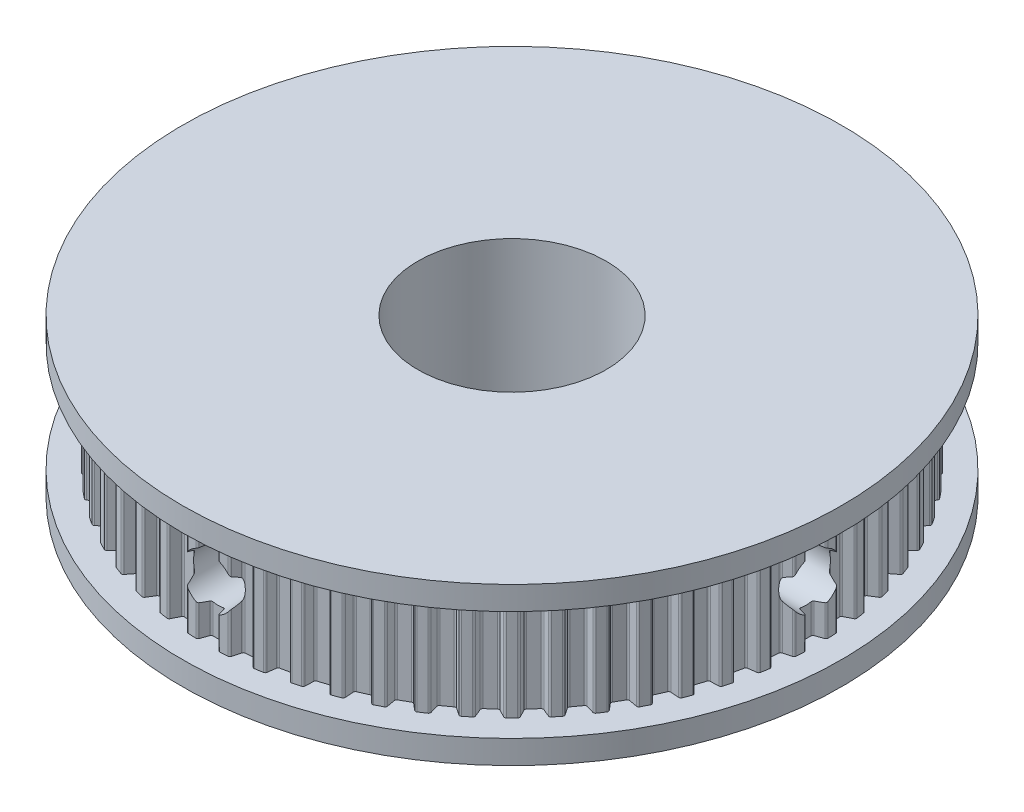
from build123d import *

# Parameters (mm, degrees)
EXTRUDE_1_DEPTH          = 3.5
EXTRUDE_1_DEPTH_BACK     = 3.5
SKETCH_1_R               = 19.405
CUT_EXTRUDE_1_DEPTH      = 29.321512142
FILLET_1_R               = 0.13
PATTERN_START            = -4
PATTERN_CIRCULAR_1_DEPTH = 8
SKETCH_3_R               = 21
EXTRUDE_2_DEPTH          = 1.5
EXTRUDE_START            = 1.5
SKETCH_4_R               = 21
EXTRUDE_3_DEPTH          = 1.5
SKETCH_5_R               = 6
CUT_EXTRUDE_2_DEPTH      = 32.336879232
SKETCH_9_W               = 1.65
SKETCH_9_H               = 21
PATTERN_CIRCULAR_2_COUNT = 2
PATTERN_CIRCULAR_2_ANGLE = 90


with BuildPart() as part:
    # 草圖1 → 填料-伸長1 (new, two sides: drawn at the far end of the back side and taken through both)
    with BuildSketch(Plane(origin=(0, 0, 0), x_dir=(1, 0, 0), z_dir=(0, 1, 0)).offset(-EXTRUDE_1_DEPTH_BACK)):
        with Locations(Location((0, 0, 0), (0, 0, 270))):
            Circle(SKETCH_1_R)
    extrude(amount=EXTRUDE_1_DEPTH + EXTRUDE_1_DEPTH_BACK)

    # 草圖2 → 除料-伸長1 (cut, through all)
    with BuildSketch(Plane.XZ.offset(3.5)):
        with BuildLine():
            Line((0, 18.715), (0, 19.405))
            ThreePointArc((0, 19.405), (-0.333532453, 19.402133416), (-0.666966365, 19.393534512))
            Line((-0.666966365, 19.393534512), (-0.42, 18.715))
            Line((-0.42, 18.715), (0, 18.715))
        make_face()
        with BuildLine():
            ThreePointArc((0.666966365, 19.393534512), (0.333532453, 19.402133416), (0, 19.405))
            Line((0, 19.405), (0, 18.715))
            Line((0, 18.715), (0.42, 18.715))
            Line((0.42, 18.715), (0.666966365, 19.393534512))
        make_face()
    extrude(amount=-CUT_EXTRUDE_1_DEPTH, mode=Mode.SUBTRACT)

    # 圓角1
    fillet_1_edges = [part.edges().sort_by_distance(p)[0] for p in [
        (0.42, 0, 18.715),
        (-0.42, 0, 18.715),
        (-0.666966365, 0, 19.393534512),
        (0.666966365, 0, 19.393534512),
    ]]
    fillet(fillet_1_edges, radius=FILLET_1_R)

    # 環狀複製排列1: read off the stored shape, not the designer's step
    # 環狀複製排列1 outline → 環狀複製排列1 (cut)
    with BuildSketch(Plane(origin=(0, 0, 0), x_dir=(1, 0, 0), z_dir=(0, 1, 0)).offset(PATTERN_START)):
        with BuildLine():
            ThreePointArc((-2.649001256, -19.132515222), (-2.705063815, -19.190443075), (-2.784498686, -19.20418163))
            ThreePointArc((-2.784498686, -19.20418163), (-2.02837483, -19.29869738), (-1.269123165, -19.363454015))
            ThreePointArc((-1.269123165, -19.363454015), (-1.343965787, -19.333500242), (-1.386759367, -19.265182191))
            Line((-1.386759367, -19.265182191), (-1.516529574, -18.744702316))
            ThreePointArc((-1.516529574, -18.744702316), (-1.557380345, -18.678039917), (-1.629079319, -18.646864316))
            Line((-1.629079319, -18.646864316), (-2.283421061, -18.578090228))
            ThreePointArc((-2.283421061, -18.578090228), (-2.360035012, -18.593677512), (-2.413852988, -18.650389825))
            Line((-2.413852988, -18.650389825), (-2.649001256, -19.132515222))
        make_face()
        with BuildLine():
            ThreePointArc((-4.634382164, -18.750809272), (-4.696192716, -18.802559656), (-4.776628505, -18.807919745))
            ThreePointArc((-4.776628505, -18.807919745), (-4.03452636, -18.980954192), (-3.286202867, -19.124719494))
            ThreePointArc((-3.286202867, -19.124719494), (-3.357504472, -19.087106627), (-3.392922443, -19.014689681))
            Line((-3.392922443, -19.014689681), (-3.467576794, -18.48349637))
            ThreePointArc((-3.467576794, -18.48349637), (-3.501235662, -18.412929086), (-3.569283123, -18.374429685))
            Line((-3.569283123, -18.374429685), (-4.212851464, -18.237635011))
            ThreePointArc((-4.212851464, -18.237635011), (-4.29067503, -18.245128568), (-4.350126236, -18.295904695))
            Line((-4.350126236, -18.295904695), (-4.634382164, -18.750809272))
        make_face()
        with BuildLine():
            ThreePointArc((-6.568987812, -18.163665531), (-6.635869147, -18.208671459), (-6.716424582, -18.205594355))
            ThreePointArc((-6.716424582, -18.205594355), (-5.996474776, -18.455251699), (-5.267278243, -18.676450544))
            ThreePointArc((-5.267278243, -18.676450544), (-5.334257635, -18.631590677), (-5.361911951, -18.555868253))
            Line((-5.361911951, -18.555868253), (-5.380632517, -18.019781369))
            ThreePointArc((-5.380632517, -18.019781369), (-5.406730708, -17.94608235), (-5.470381115, -17.900680956))
            Line((-5.470381115, -17.900680956), (-6.096124984, -17.697364449))
            ThreePointArc((-6.096124984, -17.697364449), (-6.174305515, -17.696682177), (-6.238738591, -17.740965804))
            Line((-6.238738591, -17.740965804), (-6.568987812, -18.163665531))
        make_face()
        with BuildLine():
            ThreePointArc((-8.431622255, -17.377516869), (-8.502841608, -17.415285248), (-8.582634106, -17.403804664))
            ThreePointArc((-8.582634106, -17.403804664), (-7.892724559, -17.727349606), (-7.190644216, -18.023558493))
            ThreePointArc((-7.190644216, -18.023558493), (-7.252567555, -17.97194312), (-7.272155229, -17.893744849))
            Line((-7.272155229, -17.893744849), (-7.234736904, -17.358637873))
            ThreePointArc((-7.234736904, -17.358637873), (-7.252988482, -17.282614582), (-7.311544467, -17.230808622))
            Line((-7.311544467, -17.230808622), (-7.912608083, -16.963197858))
            ThreePointArc((-7.912608083, -16.963197858), (-7.990289016, -16.954347234), (-8.058998021, -16.991653179))
            Line((-8.058998021, -16.991653179), (-8.431622255, -17.377516869))
        make_face()
        with BuildLine():
            ThreePointArc((-10.20187808, -16.400976496), (-10.276655156, -16.431093526), (-10.354810495, -16.411335247))
            ThreePointArc((-10.354810495, -16.411335247), (-9.7025, -16.80522296), (-9.035227987, -17.173196564))
            ThreePointArc((-9.035227987, -17.173196564), (-9.091416828, -17.115391194), (-9.102723253, -17.035573831))
            Line((-9.102723253, -17.035573831), (-9.009576, -16.507309507))
            ThreePointArc((-9.009576, -16.507309507), (-9.019780995, -16.42979487), (-9.072601007, -16.372151942))
            Line((-9.072601007, -16.372151942), (-9.642398993, -16.043178922))
            ThreePointArc((-9.642398993, -16.043178922), (-9.718729239, -16.026256914), (-9.790961382, -16.056176447))
            Line((-9.790961382, -16.056176447), (-10.20187808, -16.400976496))
        make_face()
        with BuildLine():
            ThreePointArc((-11.860359993, -15.244743593), (-11.93787552, -15.266879306), (-12.013537414, -15.239059807))
            ThreePointArc((-12.013537414, -15.239059807), (-11.405972821, -15.698974776), (-10.780819909, -16.1346815))
            ThreePointArc((-10.780819909, -16.1346815), (-10.830658635, -16.07131946), (-10.833559936, -15.990757502))
            Line((-10.833559936, -15.990757502), (-10.685704295, -15.475123605))
            ThreePointArc((-10.685704295, -15.475123605), (-10.687750901, -15.396966888), (-10.734256233, -15.334118539))
            Line((-10.734256233, -15.334118539), (-11.266545761, -14.94738756))
            ThreePointArc((-11.266545761, -14.94738756), (-11.340689031, -14.922579569), (-11.415652921, -14.944784885))
            Line((-11.415652921, -14.944784885), (-11.860359993, -15.244743593))
        make_face()
        with BuildLine():
            ThreePointArc((-13.388897321, -13.921486088), (-13.468302021, -13.935397961), (-13.540641502, -13.899822039))
            ThreePointArc((-13.540641502, -13.899822039), (-12.984479417, -14.420725338), (-12.408294912, -14.919391488))
            ThreePointArc((-12.408294912, -14.919391488), (-12.451237479, -14.851166987), (-12.445701869, -14.770743088))
            Line((-12.445701869, -14.770743088), (-12.244757778, -14.27338901))
            ThreePointArc((-12.244757778, -14.27338901), (-12.238623571, -14.195446516), (-12.2783047, -14.128081325))
            Line((-12.2783047, -14.128081325), (-12.767253896, -13.687829492))
            ThreePointArc((-12.767253896, -13.687829492), (-12.83839786, -13.65540732), (-12.915272178, -13.669655133))
            Line((-12.915272178, -13.669655133), (-13.388897321, -13.921486088))
        make_face()
        with BuildLine():
            ThreePointArc((-14.770743088, -12.445701869), (-14.851166987, -12.451237479), (-14.919391488, -12.408294912))
            ThreePointArc((-14.919391488, -12.408294912), (-14.420725338, -12.984479417), (-13.899822039, -13.540641502))
            ThreePointArc((-13.899822039, -13.540641502), (-13.935397961, -13.468302021), (-13.921486088, -13.388897321))
            Line((-13.921486088, -13.388897321), (-13.669655133, -12.915272178))
            ThreePointArc((-13.669655133, -12.915272178), (-13.65540732, -12.83839786), (-13.687829492, -12.767253896))
            Line((-13.687829492, -12.767253896), (-14.128081325, -12.2783047))
            ThreePointArc((-14.128081325, -12.2783047), (-14.195446516, -12.238623571), (-14.27338901, -12.244757778))
            Line((-14.27338901, -12.244757778), (-14.770743088, -12.445701869))
        make_face()
        with BuildLine():
            ThreePointArc((-15.990757502, -10.833559936), (-16.07131946, -10.830658635), (-16.1346815, -10.780819909))
            ThreePointArc((-16.1346815, -10.780819909), (-15.698974776, -11.405972821), (-15.239059807, -12.013537414))
            ThreePointArc((-15.239059807, -12.013537414), (-15.266879306, -11.93787552), (-15.244743593, -11.860359993))
            Line((-15.244743593, -11.860359993), (-14.944784885, -11.415652921))
            ThreePointArc((-14.944784885, -11.415652921), (-14.922579569, -11.340689031), (-14.94738756, -11.266545761))
            Line((-14.94738756, -11.266545761), (-15.334118539, -10.734256233))
            ThreePointArc((-15.334118539, -10.734256233), (-15.396966888, -10.687750901), (-15.475123605, -10.685704295))
            Line((-15.475123605, -10.685704295), (-15.990757502, -10.833559936))
        make_face()
        with BuildLine():
            ThreePointArc((-17.035573831, -9.102723253), (-17.115391194, -9.091416828), (-17.173196564, -9.035227987))
            ThreePointArc((-17.173196564, -9.035227987), (-16.80522296, -9.7025), (-16.411335248, -10.354810495))
            ThreePointArc((-16.411335248, -10.354810495), (-16.431093526, -10.276655156), (-16.400976496, -10.20187808))
            Line((-16.400976496, -10.20187808), (-16.056176447, -9.790961382))
            ThreePointArc((-16.056176447, -9.790961382), (-16.026256914, -9.718729239), (-16.043178922, -9.642398993))
            Line((-16.043178922, -9.642398993), (-16.372151942, -9.072601007))
            ThreePointArc((-16.372151942, -9.072601007), (-16.42979487, -9.019780995), (-16.507309507, -9.009576))
            Line((-16.507309507, -9.009576), (-17.035573831, -9.102723253))
        make_face()
        with BuildLine():
            ThreePointArc((-17.893744849, -7.272155229), (-17.97194312, -7.252567555), (-18.023558493, -7.190644216))
            ThreePointArc((-18.023558493, -7.190644216), (-17.727349606, -7.892724559), (-17.403804664, -8.582634106))
            ThreePointArc((-17.403804664, -8.582634106), (-17.415285248, -8.502841608), (-17.377516869, -8.431622255))
            Line((-17.377516869, -8.431622255), (-16.991653179, -8.058998021))
            ThreePointArc((-16.991653179, -8.058998021), (-16.954347234, -7.990289016), (-16.963197858, -7.912608083))
            Line((-16.963197858, -7.912608083), (-17.230808622, -7.311544467))
            ThreePointArc((-17.230808622, -7.311544467), (-17.282614582, -7.252988482), (-17.358637873, -7.234736904))
            Line((-17.358637873, -7.234736904), (-17.893744849, -7.272155229))
        make_face()
        with BuildLine():
            ThreePointArc((-18.555868253, -5.361911951), (-18.631590677, -5.334257635), (-18.676450544, -5.267278243))
            ThreePointArc((-18.676450544, -5.267278243), (-18.455251699, -5.996474776), (-18.205594355, -6.716424582))
            ThreePointArc((-18.205594355, -6.716424582), (-18.208671459, -6.635869147), (-18.163665531, -6.568987812))
            Line((-18.163665531, -6.568987812), (-17.740965804, -6.238738591))
            ThreePointArc((-17.740965804, -6.238738591), (-17.696682177, -6.174305515), (-17.697364449, -6.096124984))
            Line((-17.697364449, -6.096124984), (-17.900680956, -5.470381115))
            ThreePointArc((-17.900680956, -5.470381115), (-17.94608235, -5.406730708), (-18.019781369, -5.380632517))
            Line((-18.019781369, -5.380632517), (-18.555868253, -5.361911951))
        make_face()
        with BuildLine():
            ThreePointArc((-19.014689681, -3.392922443), (-19.087106627, -3.357504472), (-19.124719494, -3.286202867))
            ThreePointArc((-19.124719494, -3.286202867), (-18.980954192, -4.03452636), (-18.807919745, -4.776628505))
            ThreePointArc((-18.807919745, -4.776628505), (-18.802559656, -4.696192716), (-18.750809271, -4.634382164))
            Line((-18.750809271, -4.634382164), (-18.295904695, -4.350126236))
            ThreePointArc((-18.295904695, -4.350126236), (-18.245128568, -4.29067503), (-18.237635011, -4.212851464))
            Line((-18.237635011, -4.212851464), (-18.374429685, -3.569283123))
            ThreePointArc((-18.374429685, -3.569283123), (-18.412929086, -3.501235662), (-18.48349637, -3.467576794))
            Line((-18.48349637, -3.467576794), (-19.014689681, -3.392922443))
        make_face()
        with BuildLine():
            ThreePointArc((-19.265182191, -1.386759367), (-19.333500242, -1.343965787), (-19.363454015, -1.269123165))
            ThreePointArc((-19.363454015, -1.269123165), (-19.29869738, -2.02837483), (-19.20418163, -2.784498686))
            ThreePointArc((-19.20418163, -2.784498686), (-19.190443075, -2.705063815), (-19.132515222, -2.649001256))
            Line((-19.132515222, -2.649001256), (-18.650389825, -2.413852988))
            ThreePointArc((-18.650389825, -2.413852988), (-18.593677512, -2.360035012), (-18.578090228, -2.283421061))
            Line((-18.578090228, -2.283421061), (-18.646864316, -1.629079319))
            ThreePointArc((-18.646864316, -1.629079319), (-18.678039917, -1.557380345), (-18.744702316, -1.516529574))
            Line((-18.744702316, -1.516529574), (-19.265182191, -1.386759367))
        make_face()
        with BuildLine():
            ThreePointArc((-19.304601332, 0.634597335), (-19.368071984, 0.684297668), (-19.390038482, 0.761861317))
            ThreePointArc((-19.390038482, 0.761861317), (-19.405, 0), (-19.390038482, -0.761861317))
            ThreePointArc((-19.390038482, -0.761861317), (-19.368071984, -0.684297668), (-19.304601332, -0.634597335))
            Line((-19.304601332, -0.634597335), (-18.800537381, -0.451133061))
            ThreePointArc((-18.800537381, -0.451133061), (-18.738510234, -0.403537957), (-18.715, -0.32897302))
            Line((-18.715, -0.32897302), (-18.715, 0.32897302))
            ThreePointArc((-18.715, 0.32897302), (-18.738510234, 0.403537957), (-18.800537381, 0.451133061))
            Line((-18.800537381, 0.451133061), (-19.304601332, 0.634597335))
        make_face()
        with BuildLine():
            ThreePointArc((-19.132515222, 2.649001256), (-19.190443075, 2.705063815), (-19.20418163, 2.784498686))
            ThreePointArc((-19.20418163, 2.784498686), (-19.29869738, 2.02837483), (-19.363454015, 1.269123165))
            ThreePointArc((-19.363454015, 1.269123165), (-19.333500242, 1.343965787), (-19.265182191, 1.386759367))
            Line((-19.265182191, 1.386759367), (-18.744702316, 1.516529574))
            ThreePointArc((-18.744702316, 1.516529574), (-18.678039917, 1.557380345), (-18.646864316, 1.629079319))
            Line((-18.646864316, 1.629079319), (-18.578090228, 2.283421061))
            ThreePointArc((-18.578090228, 2.283421061), (-18.593677512, 2.360035012), (-18.650389825, 2.413852988))
            Line((-18.650389825, 2.413852988), (-19.132515222, 2.649001256))
        make_face()
        with BuildLine():
            ThreePointArc((-18.750809271, 4.634382164), (-18.802559656, 4.696192716), (-18.807919745, 4.776628505))
            ThreePointArc((-18.807919745, 4.776628505), (-18.980954192, 4.03452636), (-19.124719494, 3.286202867))
            ThreePointArc((-19.124719494, 3.286202867), (-19.087106627, 3.357504472), (-19.014689681, 3.392922443))
            Line((-19.014689681, 3.392922443), (-18.48349637, 3.467576794))
            ThreePointArc((-18.48349637, 3.467576794), (-18.412929086, 3.501235662), (-18.374429685, 3.569283123))
            Line((-18.374429685, 3.569283123), (-18.237635011, 4.212851464))
            ThreePointArc((-18.237635011, 4.212851464), (-18.245128568, 4.29067503), (-18.295904695, 4.350126236))
            Line((-18.295904695, 4.350126236), (-18.750809271, 4.634382164))
        make_face()
        with BuildLine():
            ThreePointArc((-18.163665531, 6.568987812), (-18.208671459, 6.635869147), (-18.205594355, 6.716424582))
            ThreePointArc((-18.205594355, 6.716424582), (-18.455251699, 5.996474776), (-18.676450544, 5.267278243))
            ThreePointArc((-18.676450544, 5.267278243), (-18.631590677, 5.334257635), (-18.555868253, 5.361911951))
            Line((-18.555868253, 5.361911951), (-18.019781369, 5.380632517))
            ThreePointArc((-18.019781369, 5.380632517), (-17.94608235, 5.406730708), (-17.900680956, 5.470381115))
            Line((-17.900680956, 5.470381115), (-17.697364449, 6.096124984))
            ThreePointArc((-17.697364449, 6.096124984), (-17.696682177, 6.174305515), (-17.740965804, 6.238738591))
            Line((-17.740965804, 6.238738591), (-18.163665531, 6.568987812))
        make_face()
        with BuildLine():
            ThreePointArc((-17.377516869, 8.431622255), (-17.415285248, 8.502841608), (-17.403804664, 8.582634106))
            ThreePointArc((-17.403804664, 8.582634106), (-17.727349606, 7.892724559), (-18.023558493, 7.190644216))
            ThreePointArc((-18.023558493, 7.190644216), (-17.97194312, 7.252567555), (-17.893744849, 7.272155229))
            Line((-17.893744849, 7.272155229), (-17.358637873, 7.234736904))
            ThreePointArc((-17.358637873, 7.234736904), (-17.282614582, 7.252988482), (-17.230808622, 7.311544467))
            Line((-17.230808622, 7.311544467), (-16.963197858, 7.912608083))
            ThreePointArc((-16.963197858, 7.912608083), (-16.954347234, 7.990289016), (-16.991653179, 8.058998021))
            Line((-16.991653179, 8.058998021), (-17.377516869, 8.431622255))
        make_face()
        with BuildLine():
            ThreePointArc((-16.400976496, 10.20187808), (-16.431093526, 10.276655156), (-16.411335247, 10.354810495))
            ThreePointArc((-16.411335247, 10.354810495), (-16.80522296, 9.7025), (-17.173196564, 9.035227987))
            ThreePointArc((-17.173196564, 9.035227987), (-17.115391194, 9.091416828), (-17.035573831, 9.102723253))
            Line((-17.035573831, 9.102723253), (-16.507309507, 9.009576))
            ThreePointArc((-16.507309507, 9.009576), (-16.42979487, 9.019780995), (-16.372151942, 9.072601007))
            Line((-16.372151942, 9.072601007), (-16.043178922, 9.642398993))
            ThreePointArc((-16.043178922, 9.642398993), (-16.026256914, 9.718729239), (-16.056176447, 9.790961382))
            Line((-16.056176447, 9.790961382), (-16.400976496, 10.20187808))
        make_face()
        with BuildLine():
            ThreePointArc((-15.244743593, 11.860359993), (-15.266879306, 11.93787552), (-15.239059807, 12.013537414))
            ThreePointArc((-15.239059807, 12.013537414), (-15.698974776, 11.405972821), (-16.1346815, 10.780819909))
            ThreePointArc((-16.1346815, 10.780819909), (-16.07131946, 10.830658635), (-15.990757502, 10.833559936))
            Line((-15.990757502, 10.833559936), (-15.475123605, 10.685704295))
            ThreePointArc((-15.475123605, 10.685704295), (-15.396966888, 10.687750901), (-15.334118539, 10.734256233))
            Line((-15.334118539, 10.734256233), (-14.94738756, 11.266545761))
            ThreePointArc((-14.94738756, 11.266545761), (-14.922579569, 11.340689031), (-14.944784885, 11.415652921))
            Line((-14.944784885, 11.415652921), (-15.244743593, 11.860359993))
        make_face()
        with BuildLine():
            ThreePointArc((-13.921486088, 13.388897321), (-13.935397961, 13.468302021), (-13.899822039, 13.540641502))
            ThreePointArc((-13.899822039, 13.540641502), (-14.420725338, 12.984479417), (-14.919391488, 12.408294912))
            ThreePointArc((-14.919391488, 12.408294912), (-14.851166987, 12.451237479), (-14.770743088, 12.445701869))
            Line((-14.770743088, 12.445701869), (-14.27338901, 12.244757778))
            ThreePointArc((-14.27338901, 12.244757778), (-14.195446516, 12.238623571), (-14.128081325, 12.2783047))
            Line((-14.128081325, 12.2783047), (-13.687829492, 12.767253896))
            ThreePointArc((-13.687829492, 12.767253896), (-13.65540732, 12.83839786), (-13.669655133, 12.915272178))
            Line((-13.669655133, 12.915272178), (-13.921486088, 13.388897321))
        make_face()
        with BuildLine():
            ThreePointArc((-12.445701869, 14.770743088), (-12.451237479, 14.851166987), (-12.408294912, 14.919391488))
            ThreePointArc((-12.408294912, 14.919391488), (-12.984479417, 14.420725338), (-13.540641502, 13.899822039))
            ThreePointArc((-13.540641502, 13.899822039), (-13.468302021, 13.935397961), (-13.388897321, 13.921486088))
            Line((-13.388897321, 13.921486088), (-12.915272178, 13.669655133))
            ThreePointArc((-12.915272178, 13.669655133), (-12.83839786, 13.65540732), (-12.767253896, 13.687829492))
            Line((-12.767253896, 13.687829492), (-12.2783047, 14.128081325))
            ThreePointArc((-12.2783047, 14.128081325), (-12.238623571, 14.195446516), (-12.244757778, 14.27338901))
            Line((-12.244757778, 14.27338901), (-12.445701869, 14.770743088))
        make_face()
        with BuildLine():
            ThreePointArc((-10.833559936, 15.990757502), (-10.830658635, 16.07131946), (-10.780819909, 16.1346815))
            ThreePointArc((-10.780819909, 16.1346815), (-11.405972821, 15.698974776), (-12.013537414, 15.239059807))
            ThreePointArc((-12.013537414, 15.239059807), (-11.93787552, 15.266879306), (-11.860359993, 15.244743593))
            Line((-11.860359993, 15.244743593), (-11.415652921, 14.944784885))
            ThreePointArc((-11.415652921, 14.944784885), (-11.340689031, 14.922579569), (-11.266545761, 14.94738756))
            Line((-11.266545761, 14.94738756), (-10.734256233, 15.334118539))
            ThreePointArc((-10.734256233, 15.334118539), (-10.687750901, 15.396966888), (-10.685704295, 15.475123605))
            Line((-10.685704295, 15.475123605), (-10.833559936, 15.990757502))
        make_face()
        with BuildLine():
            ThreePointArc((-9.102723253, 17.035573831), (-9.091416828, 17.115391194), (-9.035227987, 17.173196564))
            ThreePointArc((-9.035227987, 17.173196564), (-9.7025, 16.80522296), (-10.354810495, 16.411335248))
            ThreePointArc((-10.354810495, 16.411335248), (-10.276655156, 16.431093526), (-10.20187808, 16.400976496))
            Line((-10.20187808, 16.400976496), (-9.790961382, 16.056176447))
            ThreePointArc((-9.790961382, 16.056176447), (-9.718729239, 16.026256914), (-9.642398993, 16.043178922))
            Line((-9.642398993, 16.043178922), (-9.072601007, 16.372151942))
            ThreePointArc((-9.072601007, 16.372151942), (-9.019780995, 16.42979487), (-9.009576, 16.507309507))
            Line((-9.009576, 16.507309507), (-9.102723253, 17.035573831))
        make_face()
        with BuildLine():
            ThreePointArc((-7.272155229, 17.893744849), (-7.252567555, 17.97194312), (-7.190644216, 18.023558493))
            ThreePointArc((-7.190644216, 18.023558493), (-7.892724559, 17.727349606), (-8.582634106, 17.403804664))
            ThreePointArc((-8.582634106, 17.403804664), (-8.502841608, 17.415285248), (-8.431622255, 17.377516869))
            Line((-8.431622255, 17.377516869), (-8.058998021, 16.991653179))
            ThreePointArc((-8.058998021, 16.991653179), (-7.990289016, 16.954347234), (-7.912608083, 16.963197858))
            Line((-7.912608083, 16.963197858), (-7.311544467, 17.230808622))
            ThreePointArc((-7.311544467, 17.230808622), (-7.252988482, 17.282614582), (-7.234736904, 17.358637873))
            Line((-7.234736904, 17.358637873), (-7.272155229, 17.893744849))
        make_face()
        with BuildLine():
            ThreePointArc((-5.361911951, 18.555868253), (-5.334257635, 18.631590677), (-5.267278243, 18.676450544))
            ThreePointArc((-5.267278243, 18.676450544), (-5.996474776, 18.455251699), (-6.716424582, 18.205594355))
            ThreePointArc((-6.716424582, 18.205594355), (-6.635869147, 18.208671459), (-6.568987812, 18.163665531))
            Line((-6.568987812, 18.163665531), (-6.238738591, 17.740965804))
            ThreePointArc((-6.238738591, 17.740965804), (-6.174305515, 17.696682177), (-6.096124984, 17.697364449))
            Line((-6.096124984, 17.697364449), (-5.470381115, 17.900680956))
            ThreePointArc((-5.470381115, 17.900680956), (-5.406730708, 17.94608235), (-5.380632517, 18.019781369))
            Line((-5.380632517, 18.019781369), (-5.361911951, 18.555868253))
        make_face()
        with BuildLine():
            ThreePointArc((-3.392922443, 19.014689681), (-3.357504472, 19.087106627), (-3.286202867, 19.124719494))
            ThreePointArc((-3.286202867, 19.124719494), (-4.03452636, 18.980954192), (-4.776628505, 18.807919745))
            ThreePointArc((-4.776628505, 18.807919745), (-4.696192716, 18.802559656), (-4.634382164, 18.750809271))
            Line((-4.634382164, 18.750809271), (-4.350126236, 18.295904695))
            ThreePointArc((-4.350126236, 18.295904695), (-4.29067503, 18.245128568), (-4.212851464, 18.237635011))
            Line((-4.212851464, 18.237635011), (-3.569283123, 18.374429685))
            ThreePointArc((-3.569283123, 18.374429685), (-3.501235662, 18.412929086), (-3.467576794, 18.48349637))
            Line((-3.467576794, 18.48349637), (-3.392922443, 19.014689681))
        make_face()
        with BuildLine():
            ThreePointArc((-1.386759367, 19.265182191), (-1.343965787, 19.333500242), (-1.269123165, 19.363454015))
            ThreePointArc((-1.269123165, 19.363454015), (-2.02837483, 19.29869738), (-2.784498686, 19.20418163))
            ThreePointArc((-2.784498686, 19.20418163), (-2.705063815, 19.190443075), (-2.649001256, 19.132515222))
            Line((-2.649001256, 19.132515222), (-2.413852988, 18.650389825))
            ThreePointArc((-2.413852988, 18.650389825), (-2.360035012, 18.593677512), (-2.283421061, 18.578090228))
            Line((-2.283421061, 18.578090228), (-1.629079319, 18.646864316))
            ThreePointArc((-1.629079319, 18.646864316), (-1.557380345, 18.678039917), (-1.516529574, 18.744702316))
            Line((-1.516529574, 18.744702316), (-1.386759367, 19.265182191))
        make_face()
        with BuildLine():
            ThreePointArc((0.634597335, 19.304601332), (0.684297668, 19.368071984), (0.761861317, 19.390038482))
            ThreePointArc((0.761861317, 19.390038482), (0, 19.405), (-0.761861317, 19.390038482))
            ThreePointArc((-0.761861317, 19.390038482), (-0.684297668, 19.368071984), (-0.634597335, 19.304601332))
            Line((-0.634597335, 19.304601332), (-0.451133061, 18.800537381))
            ThreePointArc((-0.451133061, 18.800537381), (-0.403537957, 18.738510234), (-0.32897302, 18.715))
            Line((-0.32897302, 18.715), (0.32897302, 18.715))
            ThreePointArc((0.32897302, 18.715), (0.403537957, 18.738510234), (0.451133061, 18.800537381))
            Line((0.451133061, 18.800537381), (0.634597335, 19.304601332))
        make_face()
        with BuildLine():
            ThreePointArc((2.649001256, 19.132515222), (2.705063815, 19.190443075), (2.784498686, 19.20418163))
            ThreePointArc((2.784498686, 19.20418163), (2.02837483, 19.29869738), (1.269123165, 19.363454015))
            ThreePointArc((1.269123165, 19.363454015), (1.343965787, 19.333500242), (1.386759367, 19.265182191))
            Line((1.386759367, 19.265182191), (1.516529574, 18.744702316))
            ThreePointArc((1.516529574, 18.744702316), (1.557380345, 18.678039917), (1.629079319, 18.646864316))
            Line((1.629079319, 18.646864316), (2.283421061, 18.578090228))
            ThreePointArc((2.283421061, 18.578090228), (2.360035012, 18.593677512), (2.413852988, 18.650389825))
            Line((2.413852988, 18.650389825), (2.649001256, 19.132515222))
        make_face()
        with BuildLine():
            ThreePointArc((4.634382164, 18.750809271), (4.696192716, 18.802559656), (4.776628505, 18.807919745))
            ThreePointArc((4.776628505, 18.807919745), (4.03452636, 18.980954192), (3.286202867, 19.124719494))
            ThreePointArc((3.286202867, 19.124719494), (3.357504472, 19.087106627), (3.392922443, 19.014689681))
            Line((3.392922443, 19.014689681), (3.467576794, 18.48349637))
            ThreePointArc((3.467576794, 18.48349637), (3.501235662, 18.412929086), (3.569283123, 18.374429685))
            Line((3.569283123, 18.374429685), (4.212851464, 18.237635011))
            ThreePointArc((4.212851464, 18.237635011), (4.29067503, 18.245128568), (4.350126236, 18.295904695))
            Line((4.350126236, 18.295904695), (4.634382164, 18.750809271))
        make_face()
        with BuildLine():
            ThreePointArc((6.568987812, 18.163665531), (6.635869147, 18.208671459), (6.716424582, 18.205594355))
            ThreePointArc((6.716424582, 18.205594355), (5.996474776, 18.455251699), (5.267278243, 18.676450544))
            ThreePointArc((5.267278243, 18.676450544), (5.334257635, 18.631590677), (5.361911951, 18.555868253))
            Line((5.361911951, 18.555868253), (5.380632517, 18.019781369))
            ThreePointArc((5.380632517, 18.019781369), (5.406730708, 17.94608235), (5.470381115, 17.900680956))
            Line((5.470381115, 17.900680956), (6.096124984, 17.697364449))
            ThreePointArc((6.096124984, 17.697364449), (6.174305515, 17.696682177), (6.238738591, 17.740965804))
            Line((6.238738591, 17.740965804), (6.568987812, 18.163665531))
        make_face()
        with BuildLine():
            ThreePointArc((8.431622255, 17.377516869), (8.502841608, 17.415285248), (8.582634106, 17.403804664))
            ThreePointArc((8.582634106, 17.403804664), (7.892724559, 17.727349606), (7.190644216, 18.023558493))
            ThreePointArc((7.190644216, 18.023558493), (7.252567555, 17.97194312), (7.272155229, 17.893744849))
            Line((7.272155229, 17.893744849), (7.234736904, 17.358637873))
            ThreePointArc((7.234736904, 17.358637873), (7.252988482, 17.282614582), (7.311544467, 17.230808622))
            Line((7.311544467, 17.230808622), (7.912608083, 16.963197858))
            ThreePointArc((7.912608083, 16.963197858), (7.990289016, 16.954347234), (8.058998021, 16.991653179))
            Line((8.058998021, 16.991653179), (8.431622255, 17.377516869))
        make_face()
        with BuildLine():
            ThreePointArc((10.20187808, 16.400976496), (10.276655156, 16.431093526), (10.354810495, 16.411335247))
            ThreePointArc((10.354810495, 16.411335247), (9.7025, 16.80522296), (9.035227987, 17.173196564))
            ThreePointArc((9.035227987, 17.173196564), (9.091416828, 17.115391194), (9.102723253, 17.035573831))
            Line((9.102723253, 17.035573831), (9.009576, 16.507309507))
            ThreePointArc((9.009576, 16.507309507), (9.019780995, 16.42979487), (9.072601007, 16.372151942))
            Line((9.072601007, 16.372151942), (9.642398993, 16.043178922))
            ThreePointArc((9.642398993, 16.043178922), (9.718729239, 16.026256914), (9.790961382, 16.056176447))
            Line((9.790961382, 16.056176447), (10.20187808, 16.400976496))
        make_face()
        with BuildLine():
            ThreePointArc((11.860359993, 15.244743593), (11.93787552, 15.266879306), (12.013537414, 15.239059807))
            ThreePointArc((12.013537414, 15.239059807), (11.405972821, 15.698974776), (10.780819909, 16.1346815))
            ThreePointArc((10.780819909, 16.1346815), (10.830658635, 16.07131946), (10.833559936, 15.990757502))
            Line((10.833559936, 15.990757502), (10.685704295, 15.475123605))
            ThreePointArc((10.685704295, 15.475123605), (10.687750901, 15.396966888), (10.734256233, 15.334118539))
            Line((10.734256233, 15.334118539), (11.266545761, 14.94738756))
            ThreePointArc((11.266545761, 14.94738756), (11.340689031, 14.922579569), (11.415652921, 14.944784885))
            Line((11.415652921, 14.944784885), (11.860359993, 15.244743593))
        make_face()
        with BuildLine():
            ThreePointArc((13.388897321, 13.921486088), (13.468302021, 13.935397961), (13.540641502, 13.899822039))
            ThreePointArc((13.540641502, 13.899822039), (12.984479417, 14.420725338), (12.408294912, 14.919391488))
            ThreePointArc((12.408294912, 14.919391488), (12.451237479, 14.851166987), (12.445701869, 14.770743088))
            Line((12.445701869, 14.770743088), (12.244757778, 14.27338901))
            ThreePointArc((12.244757778, 14.27338901), (12.238623571, 14.195446516), (12.2783047, 14.128081325))
            Line((12.2783047, 14.128081325), (12.767253896, 13.687829492))
            ThreePointArc((12.767253896, 13.687829492), (12.83839786, 13.65540732), (12.915272178, 13.669655133))
            Line((12.915272178, 13.669655133), (13.388897321, 13.921486088))
        make_face()
        with BuildLine():
            ThreePointArc((14.770743088, 12.445701869), (14.851166987, 12.451237479), (14.919391488, 12.408294912))
            ThreePointArc((14.919391488, 12.408294912), (14.420725338, 12.984479417), (13.899822039, 13.540641502))
            ThreePointArc((13.899822039, 13.540641502), (13.935397961, 13.468302021), (13.921486088, 13.388897321))
            Line((13.921486088, 13.388897321), (13.669655133, 12.915272178))
            ThreePointArc((13.669655133, 12.915272178), (13.65540732, 12.83839786), (13.687829492, 12.767253896))
            Line((13.687829492, 12.767253896), (14.128081325, 12.2783047))
            ThreePointArc((14.128081325, 12.2783047), (14.195446516, 12.238623571), (14.27338901, 12.244757778))
            Line((14.27338901, 12.244757778), (14.770743088, 12.445701869))
        make_face()
        with BuildLine():
            ThreePointArc((15.990757502, 10.833559936), (16.07131946, 10.830658635), (16.1346815, 10.780819909))
            ThreePointArc((16.1346815, 10.780819909), (15.698974776, 11.405972821), (15.239059807, 12.013537414))
            ThreePointArc((15.239059807, 12.013537414), (15.266879306, 11.93787552), (15.244743593, 11.860359993))
            Line((15.244743593, 11.860359993), (14.944784885, 11.415652921))
            ThreePointArc((14.944784885, 11.415652921), (14.922579569, 11.340689031), (14.94738756, 11.266545761))
            Line((14.94738756, 11.266545761), (15.334118539, 10.734256233))
            ThreePointArc((15.334118539, 10.734256233), (15.396966888, 10.687750901), (15.475123605, 10.685704295))
            Line((15.475123605, 10.685704295), (15.990757502, 10.833559936))
        make_face()
        with BuildLine():
            ThreePointArc((17.035573831, 9.102723253), (17.115391194, 9.091416828), (17.173196564, 9.035227987))
            ThreePointArc((17.173196564, 9.035227987), (16.80522296, 9.7025), (16.411335248, 10.354810495))
            ThreePointArc((16.411335248, 10.354810495), (16.431093526, 10.276655156), (16.400976496, 10.20187808))
            Line((16.400976496, 10.20187808), (16.056176447, 9.790961382))
            ThreePointArc((16.056176447, 9.790961382), (16.026256914, 9.718729239), (16.043178922, 9.642398993))
            Line((16.043178922, 9.642398993), (16.372151942, 9.072601007))
            ThreePointArc((16.372151942, 9.072601007), (16.42979487, 9.019780995), (16.507309507, 9.009576))
            Line((16.507309507, 9.009576), (17.035573831, 9.102723253))
        make_face()
        with BuildLine():
            ThreePointArc((17.893744849, 7.272155229), (17.97194312, 7.252567555), (18.023558493, 7.190644216))
            ThreePointArc((18.023558493, 7.190644216), (17.727349606, 7.892724559), (17.403804664, 8.582634106))
            ThreePointArc((17.403804664, 8.582634106), (17.415285248, 8.502841608), (17.377516869, 8.431622255))
            Line((17.377516869, 8.431622255), (16.991653179, 8.058998021))
            ThreePointArc((16.991653179, 8.058998021), (16.954347234, 7.990289016), (16.963197858, 7.912608083))
            Line((16.963197858, 7.912608083), (17.230808622, 7.311544467))
            ThreePointArc((17.230808622, 7.311544467), (17.282614582, 7.252988482), (17.358637873, 7.234736904))
            Line((17.358637873, 7.234736904), (17.893744849, 7.272155229))
        make_face()
        with BuildLine():
            ThreePointArc((18.555868253, 5.361911951), (18.631590677, 5.334257635), (18.676450544, 5.267278243))
            ThreePointArc((18.676450544, 5.267278243), (18.455251699, 5.996474776), (18.205594355, 6.716424582))
            ThreePointArc((18.205594355, 6.716424582), (18.208671459, 6.635869147), (18.163665531, 6.568987812))
            Line((18.163665531, 6.568987812), (17.740965804, 6.238738591))
            ThreePointArc((17.740965804, 6.238738591), (17.696682177, 6.174305515), (17.697364449, 6.096124984))
            Line((17.697364449, 6.096124984), (17.900680956, 5.470381115))
            ThreePointArc((17.900680956, 5.470381115), (17.94608235, 5.406730708), (18.019781369, 5.380632517))
            Line((18.019781369, 5.380632517), (18.555868253, 5.361911951))
        make_face()
        with BuildLine():
            ThreePointArc((19.014689681, 3.392922443), (19.087106627, 3.357504472), (19.124719494, 3.286202867))
            ThreePointArc((19.124719494, 3.286202867), (18.980954192, 4.03452636), (18.807919745, 4.776628505))
            ThreePointArc((18.807919745, 4.776628505), (18.802559656, 4.696192716), (18.750809271, 4.634382164))
            Line((18.750809271, 4.634382164), (18.295904695, 4.350126236))
            ThreePointArc((18.295904695, 4.350126236), (18.245128568, 4.29067503), (18.237635011, 4.212851464))
            Line((18.237635011, 4.212851464), (18.374429685, 3.569283123))
            ThreePointArc((18.374429685, 3.569283123), (18.412929086, 3.501235662), (18.48349637, 3.467576794))
            Line((18.48349637, 3.467576794), (19.014689681, 3.392922443))
        make_face()
        with BuildLine():
            ThreePointArc((19.265182191, 1.386759367), (19.333500242, 1.343965787), (19.363454015, 1.269123165))
            ThreePointArc((19.363454015, 1.269123165), (19.29869738, 2.02837483), (19.20418163, 2.784498686))
            ThreePointArc((19.20418163, 2.784498686), (19.190443075, 2.705063815), (19.132515222, 2.649001256))
            Line((19.132515222, 2.649001256), (18.650389825, 2.413852988))
            ThreePointArc((18.650389825, 2.413852988), (18.593677512, 2.360035012), (18.578090228, 2.283421061))
            Line((18.578090228, 2.283421061), (18.646864316, 1.629079319))
            ThreePointArc((18.646864316, 1.629079319), (18.678039917, 1.557380345), (18.744702316, 1.516529574))
            Line((18.744702316, 1.516529574), (19.265182191, 1.386759367))
        make_face()
        with BuildLine():
            ThreePointArc((19.304601332, -0.634597335), (19.368071984, -0.684297668), (19.390038482, -0.761861317))
            ThreePointArc((19.390038482, -0.761861317), (19.405, 0), (19.390038482, 0.761861317))
            ThreePointArc((19.390038482, 0.761861317), (19.368071984, 0.684297668), (19.304601332, 0.634597335))
            Line((19.304601332, 0.634597335), (18.800537381, 0.451133061))
            ThreePointArc((18.800537381, 0.451133061), (18.738510234, 0.403537957), (18.715, 0.32897302))
            Line((18.715, 0.32897302), (18.715, -0.32897302))
            ThreePointArc((18.715, -0.32897302), (18.738510234, -0.403537957), (18.800537381, -0.451133061))
            Line((18.800537381, -0.451133061), (19.304601332, -0.634597335))
        make_face()
        with BuildLine():
            ThreePointArc((19.132515222, -2.649001256), (19.190443075, -2.705063815), (19.20418163, -2.784498686))
            ThreePointArc((19.20418163, -2.784498686), (19.29869738, -2.02837483), (19.363454015, -1.269123165))
            ThreePointArc((19.363454015, -1.269123165), (19.333500242, -1.343965787), (19.265182191, -1.386759367))
            Line((19.265182191, -1.386759367), (18.744702316, -1.516529574))
            ThreePointArc((18.744702316, -1.516529574), (18.678039917, -1.557380345), (18.646864316, -1.629079319))
            Line((18.646864316, -1.629079319), (18.578090228, -2.283421061))
            ThreePointArc((18.578090228, -2.283421061), (18.593677512, -2.360035012), (18.650389825, -2.413852988))
            Line((18.650389825, -2.413852988), (19.132515222, -2.649001256))
        make_face()
        with BuildLine():
            ThreePointArc((18.750809271, -4.634382164), (18.802559656, -4.696192716), (18.807919745, -4.776628505))
            ThreePointArc((18.807919745, -4.776628505), (18.980954192, -4.03452636), (19.124719494, -3.286202867))
            ThreePointArc((19.124719494, -3.286202867), (19.087106627, -3.357504472), (19.014689681, -3.392922443))
            Line((19.014689681, -3.392922443), (18.48349637, -3.467576794))
            ThreePointArc((18.48349637, -3.467576794), (18.412929086, -3.501235662), (18.374429685, -3.569283123))
            Line((18.374429685, -3.569283123), (18.237635011, -4.212851464))
            ThreePointArc((18.237635011, -4.212851464), (18.245128568, -4.29067503), (18.295904695, -4.350126236))
            Line((18.295904695, -4.350126236), (18.750809271, -4.634382164))
        make_face()
        with BuildLine():
            ThreePointArc((18.163665531, -6.568987812), (18.208671459, -6.635869147), (18.205594355, -6.716424582))
            ThreePointArc((18.205594355, -6.716424582), (18.455251699, -5.996474776), (18.676450544, -5.267278243))
            ThreePointArc((18.676450544, -5.267278243), (18.631590677, -5.334257635), (18.555868253, -5.361911951))
            Line((18.555868253, -5.361911951), (18.019781369, -5.380632517))
            ThreePointArc((18.019781369, -5.380632517), (17.94608235, -5.406730708), (17.900680956, -5.470381115))
            Line((17.900680956, -5.470381115), (17.697364449, -6.096124984))
            ThreePointArc((17.697364449, -6.096124984), (17.696682177, -6.174305515), (17.740965804, -6.238738591))
            Line((17.740965804, -6.238738591), (18.163665531, -6.568987812))
        make_face()
        with BuildLine():
            ThreePointArc((17.377516869, -8.431622255), (17.415285248, -8.502841608), (17.403804664, -8.582634106))
            ThreePointArc((17.403804664, -8.582634106), (17.727349606, -7.892724559), (18.023558493, -7.190644216))
            ThreePointArc((18.023558493, -7.190644216), (17.97194312, -7.252567555), (17.893744849, -7.272155229))
            Line((17.893744849, -7.272155229), (17.358637873, -7.234736904))
            ThreePointArc((17.358637873, -7.234736904), (17.282614582, -7.252988482), (17.230808622, -7.311544467))
            Line((17.230808622, -7.311544467), (16.963197858, -7.912608083))
            ThreePointArc((16.963197858, -7.912608083), (16.954347234, -7.990289016), (16.991653179, -8.058998021))
            Line((16.991653179, -8.058998021), (17.377516869, -8.431622255))
        make_face()
        with BuildLine():
            ThreePointArc((16.400976496, -10.20187808), (16.431093526, -10.276655156), (16.411335247, -10.354810495))
            ThreePointArc((16.411335247, -10.354810495), (16.80522296, -9.7025), (17.173196564, -9.035227987))
            ThreePointArc((17.173196564, -9.035227987), (17.115391194, -9.091416828), (17.035573831, -9.102723253))
            Line((17.035573831, -9.102723253), (16.507309507, -9.009576))
            ThreePointArc((16.507309507, -9.009576), (16.42979487, -9.019780995), (16.372151942, -9.072601007))
            Line((16.372151942, -9.072601007), (16.043178922, -9.642398993))
            ThreePointArc((16.043178922, -9.642398993), (16.026256914, -9.718729239), (16.056176447, -9.790961382))
            Line((16.056176447, -9.790961382), (16.400976496, -10.20187808))
        make_face()
        with BuildLine():
            ThreePointArc((15.244743593, -11.860359993), (15.266879306, -11.93787552), (15.239059807, -12.013537414))
            ThreePointArc((15.239059807, -12.013537414), (15.698974776, -11.405972821), (16.1346815, -10.780819909))
            ThreePointArc((16.1346815, -10.780819909), (16.07131946, -10.830658635), (15.990757502, -10.833559936))
            Line((15.990757502, -10.833559936), (15.475123605, -10.685704295))
            ThreePointArc((15.475123605, -10.685704295), (15.396966888, -10.687750901), (15.334118539, -10.734256233))
            Line((15.334118539, -10.734256233), (14.94738756, -11.266545761))
            ThreePointArc((14.94738756, -11.266545761), (14.922579569, -11.340689031), (14.944784885, -11.415652921))
            Line((14.944784885, -11.415652921), (15.244743593, -11.860359993))
        make_face()
        with BuildLine():
            ThreePointArc((13.921486088, -13.388897321), (13.935397961, -13.468302021), (13.899822039, -13.540641502))
            ThreePointArc((13.899822039, -13.540641502), (14.420725338, -12.984479417), (14.919391488, -12.408294912))
            ThreePointArc((14.919391488, -12.408294912), (14.851166987, -12.451237479), (14.770743088, -12.445701869))
            Line((14.770743088, -12.445701869), (14.27338901, -12.244757778))
            ThreePointArc((14.27338901, -12.244757778), (14.195446516, -12.238623571), (14.128081325, -12.2783047))
            Line((14.128081325, -12.2783047), (13.687829492, -12.767253896))
            ThreePointArc((13.687829492, -12.767253896), (13.65540732, -12.83839786), (13.669655133, -12.915272178))
            Line((13.669655133, -12.915272178), (13.921486088, -13.388897321))
        make_face()
        with BuildLine():
            ThreePointArc((12.445701869, -14.770743088), (12.451237479, -14.851166987), (12.408294912, -14.919391488))
            ThreePointArc((12.408294912, -14.919391488), (12.984479417, -14.420725338), (13.540641502, -13.899822039))
            ThreePointArc((13.540641502, -13.899822039), (13.468302021, -13.935397961), (13.388897321, -13.921486088))
            Line((13.388897321, -13.921486088), (12.915272178, -13.669655133))
            ThreePointArc((12.915272178, -13.669655133), (12.83839786, -13.65540732), (12.767253896, -13.687829492))
            Line((12.767253896, -13.687829492), (12.2783047, -14.128081325))
            ThreePointArc((12.2783047, -14.128081325), (12.238623571, -14.195446516), (12.244757778, -14.27338901))
            Line((12.244757778, -14.27338901), (12.445701869, -14.770743088))
        make_face()
        with BuildLine():
            ThreePointArc((10.833559936, -15.990757502), (10.830658635, -16.07131946), (10.780819909, -16.1346815))
            ThreePointArc((10.780819909, -16.1346815), (11.405972821, -15.698974776), (12.013537414, -15.239059807))
            ThreePointArc((12.013537414, -15.239059807), (11.93787552, -15.266879306), (11.860359993, -15.244743593))
            Line((11.860359993, -15.244743593), (11.415652921, -14.944784885))
            ThreePointArc((11.415652921, -14.944784885), (11.340689031, -14.922579569), (11.266545761, -14.94738756))
            Line((11.266545761, -14.94738756), (10.734256233, -15.334118539))
            ThreePointArc((10.734256233, -15.334118539), (10.687750901, -15.396966888), (10.685704295, -15.475123605))
            Line((10.685704295, -15.475123605), (10.833559936, -15.990757502))
        make_face()
        with BuildLine():
            ThreePointArc((9.102723253, -17.035573831), (9.091416828, -17.115391194), (9.035227987, -17.173196564))
            ThreePointArc((9.035227987, -17.173196564), (9.7025, -16.80522296), (10.354810495, -16.411335248))
            ThreePointArc((10.354810495, -16.411335248), (10.276655156, -16.431093526), (10.20187808, -16.400976496))
            Line((10.20187808, -16.400976496), (9.790961382, -16.056176447))
            ThreePointArc((9.790961382, -16.056176447), (9.718729239, -16.026256914), (9.642398993, -16.043178922))
            Line((9.642398993, -16.043178922), (9.072601007, -16.372151942))
            ThreePointArc((9.072601007, -16.372151942), (9.019780995, -16.42979487), (9.009576, -16.507309507))
            Line((9.009576, -16.507309507), (9.102723253, -17.035573831))
        make_face()
        with BuildLine():
            ThreePointArc((7.272155229, -17.893744849), (7.252567555, -17.97194312), (7.190644216, -18.023558493))
            ThreePointArc((7.190644216, -18.023558493), (7.892724559, -17.727349606), (8.582634106, -17.403804664))
            ThreePointArc((8.582634106, -17.403804664), (8.502841608, -17.415285248), (8.431622255, -17.377516869))
            Line((8.431622255, -17.377516869), (8.058998021, -16.991653179))
            ThreePointArc((8.058998021, -16.991653179), (7.990289016, -16.954347234), (7.912608083, -16.963197858))
            Line((7.912608083, -16.963197858), (7.311544467, -17.230808622))
            ThreePointArc((7.311544467, -17.230808622), (7.252988482, -17.282614582), (7.234736904, -17.358637873))
            Line((7.234736904, -17.358637873), (7.272155229, -17.893744849))
        make_face()
        with BuildLine():
            ThreePointArc((5.361911951, -18.555868253), (5.334257635, -18.631590677), (5.267278243, -18.676450544))
            ThreePointArc((5.267278243, -18.676450544), (5.996474776, -18.455251699), (6.716424582, -18.205594355))
            ThreePointArc((6.716424582, -18.205594355), (6.635869147, -18.208671459), (6.568987812, -18.163665531))
            Line((6.568987812, -18.163665531), (6.238738591, -17.740965804))
            ThreePointArc((6.238738591, -17.740965804), (6.174305515, -17.696682177), (6.096124984, -17.697364449))
            Line((6.096124984, -17.697364449), (5.470381115, -17.900680956))
            ThreePointArc((5.470381115, -17.900680956), (5.406730708, -17.94608235), (5.380632517, -18.019781369))
            Line((5.380632517, -18.019781369), (5.361911951, -18.555868253))
        make_face()
        with BuildLine():
            ThreePointArc((3.392922443, -19.014689681), (3.357504472, -19.087106627), (3.286202867, -19.124719494))
            ThreePointArc((3.286202867, -19.124719494), (4.03452636, -18.980954192), (4.776628505, -18.807919745))
            ThreePointArc((4.776628505, -18.807919745), (4.696192716, -18.802559656), (4.634382164, -18.750809271))
            Line((4.634382164, -18.750809271), (4.350126236, -18.295904695))
            ThreePointArc((4.350126236, -18.295904695), (4.29067503, -18.245128568), (4.212851464, -18.237635011))
            Line((4.212851464, -18.237635011), (3.569283123, -18.374429685))
            ThreePointArc((3.569283123, -18.374429685), (3.501235662, -18.412929086), (3.467576794, -18.48349637))
            Line((3.467576794, -18.48349637), (3.392922443, -19.014689681))
        make_face()
        with BuildLine():
            Line((2.283421061, -18.578090228), (1.629079319, -18.646864316))
            ThreePointArc((1.629079319, -18.646864316), (1.557380345, -18.678039917), (1.516529574, -18.744702316))
            Line((1.516529574, -18.744702316), (1.386759367, -19.265182191))
            ThreePointArc((1.386759367, -19.265182191), (1.343965787, -19.333500242), (1.269123165, -19.363454015))
            ThreePointArc((1.269123165, -19.363454015), (2.02837483, -19.29869738), (2.784498686, -19.20418163))
            ThreePointArc((2.784498686, -19.20418163), (2.705063815, -19.190443075), (2.649001256, -19.132515222))
            Line((2.649001256, -19.132515222), (2.413852988, -18.650389825))
            ThreePointArc((2.413852988, -18.650389825), (2.360035012, -18.593677512), (2.283421061, -18.578090228))
        make_face()
    extrude(amount=PATTERN_CIRCULAR_1_DEPTH, mode=Mode.SUBTRACT)

    # 草圖3 → 填料-伸長2 (add)
    with BuildSketch(Plane(origin=(0, 3.5, 0), x_dir=(1, 0, 0), z_dir=(0, 1, 0))):
        with Locations(Location((0, 0, 0), (0, 0, 270))):
            Circle(SKETCH_3_R)
    extrude(amount=EXTRUDE_2_DEPTH)

    # 草圖4 → 填料-伸長3 (add)
    with BuildSketch(Plane.XZ.offset(3.5).offset(EXTRUDE_START)):
        with Locations(Location((0, 0, 0), (0, 0, 90))):
            Circle(SKETCH_4_R)
    extrude(amount=-EXTRUDE_3_DEPTH)

    # 草圖5 → 除料-伸長2 (cut, through all)
    with BuildSketch(Plane.XZ.offset(5)):
        with Locations(Location((0, 0, 0), (0, 0, 270))):
            Circle(SKETCH_5_R)
    extrude(amount=-CUT_EXTRUDE_2_DEPTH, mode=Mode.SUBTRACT)

    # 草圖9 → M4x0.7 螺紋孔1 (revolve, cut)
    with BuildSketch(Plane.YZ):
        with Locations((0.825, 10.5)):
            Rectangle(SKETCH_9_W, SKETCH_9_H)
    m4x0_7_1 = revolve(axis=Axis((0, 0, -6.35), (0, 0, 1)), mode=Mode.SUBTRACT)

    # 環狀複製排列2: M4x0.7 螺紋孔1 ×2 about axis
    pattern_circular_2_axis = Axis((0, 5, 0), (0, 1, 0))
    for i in range(1, PATTERN_CIRCULAR_2_COUNT):
        add(m4x0_7_1.rotate(pattern_circular_2_axis, i * PATTERN_CIRCULAR_2_ANGLE / (PATTERN_CIRCULAR_2_COUNT - 1)), mode=Mode.SUBTRACT)


solid = part.part
